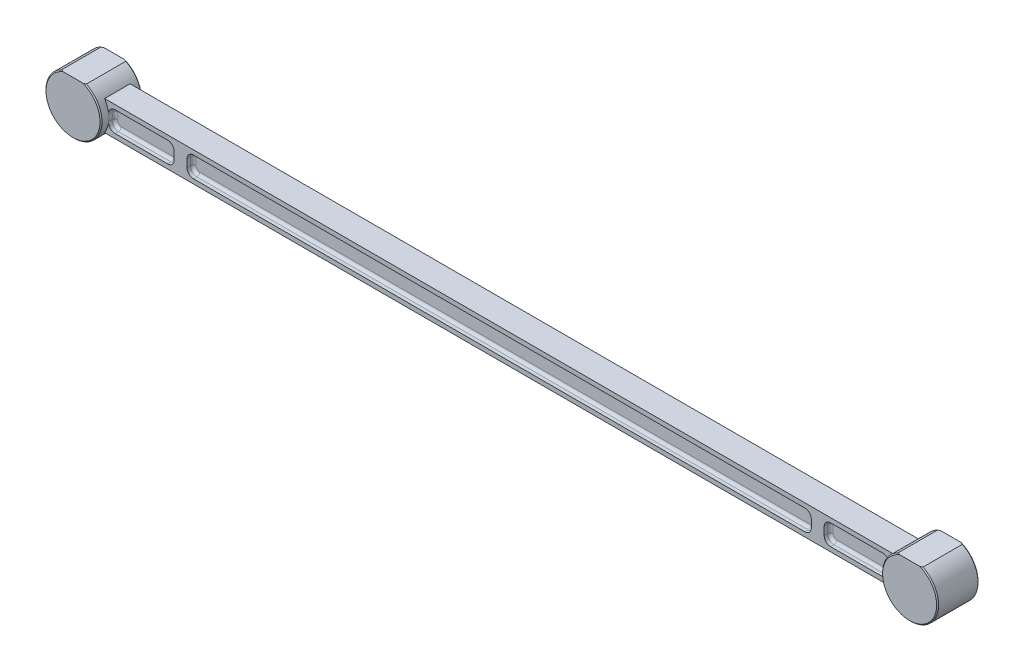
from build123d import *
from build123d.topology import SkipClean

# Parameters (mm, degrees)
EXTRUDE1_DEPTH      = 19.812
EXTRUDE1_DEPTH_BACK = 19.812
CUT_EXTRUDE1_DEPTH  = 9.652
CUT_EXTRUDE2_START  = -9.652
CUT_EXTRUDE2_DEPTH  = 9.652
EXTRUDE2_DEPTH      = 12.192
EXTRUDE2_DEPTH_BACK = 52.07
CHAMFER1_SIZE       = 1.524
FILLET1_R           = 4.318


with BuildPart() as part:
    # Sketch3 → Extrude1 (new, two sides: drawn at the far end of the back side and taken through both)
    with BuildSketch(Plane.XY.offset(-EXTRUDE1_DEPTH_BACK)):
        with BuildLine():
            Line((-19.262201877, 39.000001091), (19.262201877, 39.000001091))
            ThreePointArc((19.262201877, 39.000001091), (29.207695203, 32.232639469), (36.919270155, 22.999999944))
            Line((36.919270155, 22.999999944), (1263.080729845, 22.999999944))
            ThreePointArc((1263.080729845, 22.999999944), (1270.792304797, 32.232639469), (1280.737798123, 39.000001091))
            Line((1280.737798123, 39.000001091), (1319.262201877, 39.000001091))
            ThreePointArc((1319.262201877, 39.000001091), (1332.232639491, -29.207695179), (1263.080729879, -23))
            Line((1263.080729879, -23), (36.919270121, -23))
            ThreePointArc((36.919270121, -23), (-32.232639491, -29.207695179), (-19.262201877, 39.000001091))
        make_face()
    extrude(amount=EXTRUDE1_DEPTH + EXTRUDE1_DEPTH_BACK)

    # Sketch4 → Cut-Extrude1 (cut)
    with BuildSketch(Plane.XY.offset(19.812)):
        with BuildLine():
            Line((53.16249, 15.999999944), (134.999999965, 15.999999944))
            ThreePointArc((134.999999965, 15.999999944), (142.07106777, 13.071067778), (145, 6))
            Line((145, 6), (145, -6))
            ThreePointArc((145, -6), (142.071067812, -13.071067812), (135, -16))
            Line((135, -16), (53.16249, -16))
            ThreePointArc((53.16249, -16), (45.705446207, -12.662769534), (43.22557716, -4.878499573))
            ThreePointArc((43.22557716, -4.878499573), (43.500004769, 5.034e-06), (43.225576025, 4.878509576))
            ThreePointArc((43.225576025, 4.878509576), (45.705445424, 12.662776965), (53.16249, 15.999999944))
        make_face()
        with BuildLine():
            Line((165, 6), (165, -6))
            ThreePointArc((165, -6), (167.928932188, -13.071067812), (175, -16))
            Line((175, -16), (1124.999999965, -16))
            ThreePointArc((1124.999999965, -16), (1132.071067777, -13.071067812), (1134.999999965, -6))
            Line((1134.999999965, -6), (1134.999999965, 6))
            ThreePointArc((1134.999999965, 6), (1132.071067777, 13.071067812), (1124.999999965, 16))
            Line((1124.999999965, 16), (175, 16))
            ThreePointArc((175, 16), (167.928932188, 13.071067812), (165, 6))
        make_face()
        with BuildLine():
            Line((1164.999999965, -16), (1246.837509965, -16))
            ThreePointArc((1246.837509965, -16), (1254.294553758, -12.662769534), (1256.774422805, -4.878499573))
            ThreePointArc((1256.774422805, -4.878499573), (1256.499995196, 5.034e-06), (1256.774423941, 4.878509576))
            ThreePointArc((1256.774423941, 4.878509576), (1254.294554541, 12.662776965), (1246.837509965, 15.999999944))
            Line((1246.837509965, 15.999999944), (1165, 15.999999944))
            ThreePointArc((1165, 15.999999944), (1157.928932195, 13.071067778), (1154.999999965, 6))
            Line((1154.999999965, 6), (1154.999999965, -6))
            ThreePointArc((1154.999999965, -6), (1157.928932153, -13.071067812), (1164.999999965, -16))
        make_face()
    extrude(amount=-CUT_EXTRUDE1_DEPTH, mode=Mode.SUBTRACT)

    # Sketch5 → Cut-Extrude2 (cut)
    with BuildSketch(Plane(origin=(0, 0, -19.812), x_dir=(-1, 0, 0), z_dir=(0, 0, -1)).offset(CUT_EXTRUDE2_START)):
        with BuildLine():
            Line((-165, -6), (-165, 6))
            ThreePointArc((-165, 6), (-167.928932188, 13.071067812), (-175, 16))
            Line((-175, 16), (-1124.999999965, 16))
            ThreePointArc((-1124.999999965, 16), (-1132.071067777, 13.071067812), (-1134.999999965, 6))
            Line((-1134.999999965, 6), (-1134.999999965, -6))
            ThreePointArc((-1134.999999965, -6), (-1132.071067777, -13.071067812), (-1124.999999965, -16))
            Line((-1124.999999965, -16), (-175, -16))
            ThreePointArc((-175, -16), (-167.928932188, -13.071067812), (-165, -6))
        make_face()
        with BuildLine():
            Line((-1165, 15.999999944), (-1246.837509965, 15.999999944))
            ThreePointArc((-1246.837509965, 15.999999944), (-1254.294554541, 12.662776965), (-1256.774423941, 4.878509576))
            ThreePointArc((-1256.774423941, 4.878509576), (-1256.499995196, 5.034e-06), (-1256.774422805, -4.878499573))
            ThreePointArc((-1256.774422805, -4.878499573), (-1254.294553758, -12.662769534), (-1246.837509965, -16))
            Line((-1246.837509965, -16), (-1164.999999965, -16))
            ThreePointArc((-1164.999999965, -16), (-1157.928932153, -13.071067812), (-1154.999999965, -6))
            Line((-1154.999999965, -6), (-1154.999999965, 6))
            ThreePointArc((-1154.999999965, 6), (-1157.928932195, 13.071067778), (-1165, 15.999999944))
        make_face()
        with BuildLine():
            Line((-135, -16), (-53.16249, -16))
            ThreePointArc((-53.16249, -16), (-45.705446207, -12.662769534), (-43.22557716, -4.878499573))
            ThreePointArc((-43.22557716, -4.878499573), (-43.500004769, 5.034e-06), (-43.225576025, 4.878509576))
            ThreePointArc((-43.225576025, 4.878509576), (-45.705445424, 12.662776965), (-53.16249, 15.999999944))
            Line((-53.16249, 15.999999944), (-134.999999965, 15.999999944))
            ThreePointArc((-134.999999965, 15.999999944), (-142.07106777, 13.071067778), (-145, 6))
            Line((-145, 6), (-145, -6))
            ThreePointArc((-145, -6), (-142.071067812, -13.071067812), (-135, -16))
        make_face()
    extrude(amount=CUT_EXTRUDE2_DEPTH, mode=Mode.SUBTRACT)

    # Sketch6 → Extrude2 (add, two sides: drawn at the far end of the back side and taken through both)
    with SkipClean():  # the faces are left unmerged after this step: merging them gives an invalid solid
        with BuildSketch(Plane.XY.offset(19.812).offset(-EXTRUDE2_DEPTH_BACK)):
            with BuildLine():
                Line((1319.262201877, 39.000001091), (1280.737798123, 39.000001091))
                ThreePointArc((1280.737798123, 39.000001091), (1258.165929163, 11.913984366), (1263.080729879, -23))
                ThreePointArc((1263.080729879, -23), (1332.232639491, -29.207695179), (1319.262201877, 39.000001091))
            make_face()
            with BuildLine():
                Line((19.262201877, 39.000001091), (-19.262201877, 39.000001091))
                ThreePointArc((-19.262201877, 39.000001091), (-32.232639491, -29.207695179), (36.919270121, -23))
                ThreePointArc((36.919270121, -23), (41.834070837, 11.913984366), (19.262201877, 39.000001091))
            make_face()
        extrude(amount=EXTRUDE2_DEPTH + EXTRUDE2_DEPTH_BACK)
    add(part.part.scale(1), mode=Mode.REPLACE)  # the faces are merged on a copy

    # Chamfer1
    chamfer1_edges = [part.edges().sort_by_distance(p)[0] for p in [
        (1300, -43.4975, -32.258),
        (0, -43.4975, -32.258),
        (1300, -43.4975, 32.004),
        (0, -43.4975, 32.004),
    ]]
    chamfer(chamfer1_edges, length=CHAMFER1_SIZE)

    # Fillet1
    fillet1_edges = [part.edges().sort_by_distance(p)[0] for p in [
        (1205.918754965, -16, 10.16),
        (1157.928932153, -13.071067812, 10.16),
        (1154.999999965, 0, 10.16),
        (1157.928932195, 13.071067778, 10.16),
        (1205.918754983, 15.999999944, 10.16),
        (1254.294554541, 12.662776965, 10.16),
        (1256.499995196, 5.034e-06, 10.16),
        (1254.294553758, -12.662769534, 10.16),
        (649.999999983, 16, 10.16),
        (1132.071067777, 13.071067812, 10.16),
        (1134.999999965, 0, 10.16),
        (1132.071067777, -13.071067812, 10.16),
        (649.999999983, -16, 10.16),
        (167.928932188, -13.071067812, 10.16),
        (165, 0, 10.16),
        (167.928932188, 13.071067812, 10.16),
        (94.081244983, 15.999999944, 10.16),
        (142.07106777, 13.071067778, 10.16),
        (145, 0, 10.16),
        (142.071067812, -13.071067812, 10.16),
        (94.081245, -16, 10.16),
        (45.705446207, -12.662769534, 10.16),
        (43.500004769, 5.034e-06, 10.16),
        (45.705445424, 12.662776965, 10.16),
        (45.705446207, -12.662769534, -10.16),
        (94.081245, -16, -10.16),
        (142.071067812, -13.071067812, -10.16),
        (145, 0, -10.16),
        (142.07106777, 13.071067778, -10.16),
        (94.081244983, 15.999999944, -10.16),
        (45.705445424, 12.662776965, -10.16),
        (43.500004769, 5.034e-06, -10.16),
        (165, 0, -10.16),
        (167.928932188, -13.071067812, -10.16),
        (649.999999983, -16, -10.16),
        (1132.071067777, -13.071067812, -10.16),
        (1134.999999965, 0, -10.16),
        (1132.071067777, 13.071067812, -10.16),
        (649.999999983, 16, -10.16),
        (167.928932188, 13.071067812, -10.16),
        (1254.294554541, 12.662776965, -10.16),
        (1205.918754983, 15.999999944, -10.16),
        (1157.928932195, 13.071067778, -10.16),
        (1154.999999965, 0, -10.16),
        (1157.928932153, -13.071067812, -10.16),
        (1205.918754965, -16, -10.16),
        (1254.294553758, -12.662769534, -10.16),
        (1256.499995196, 5.034e-06, -10.16),
    ]]
    fillet(fillet1_edges, radius=FILLET1_R)


solid = part.part
